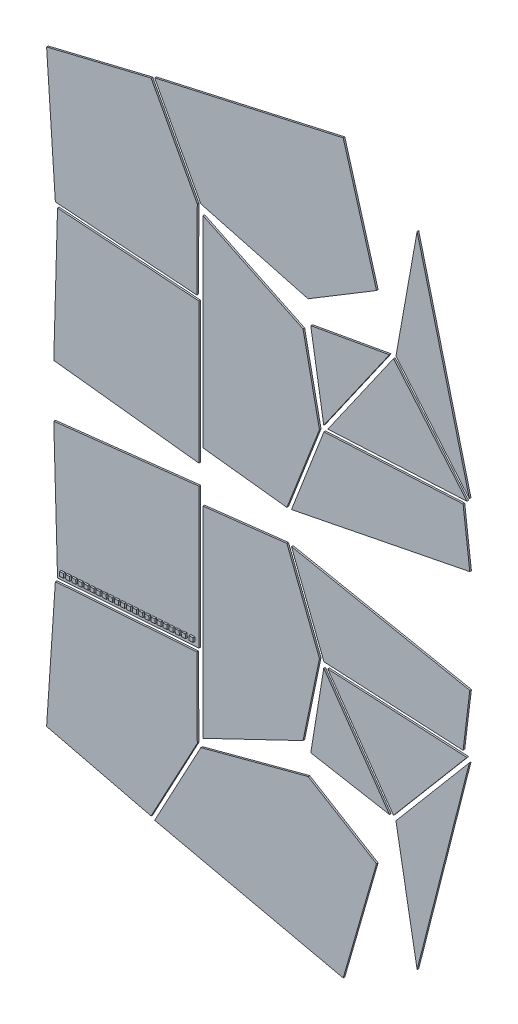
from build123d import *

# Parameters (mm, degrees)
PCBS_DEPTH                = 0.8
PCBS_2_DEPTH              = 0.8
PCBS_3_DEPTH              = 0.8
PCBS_4_DEPTH              = 0.8
PCBS_5_DEPTH              = 0.8
PCBS_6_DEPTH              = 0.8
PCBS_7_DEPTH              = 0.8
PCBS_8_DEPTH              = 0.8
PCBS_9_DEPTH              = 0.8
PCBS_10_DEPTH             = 0.8
PCBS_11_DEPTH             = 0.8
PCBS_12_DEPTH             = 0.8
PCBS_13_DEPTH             = 0.8
PCBS_14_DEPTH             = 0.8
PCBS_15_DEPTH             = 0.8
PCBS_16_DEPTH             = 0.8
BOSS_EXTRUDE3_START       = 65.923845769
BOSS_EXTRUDE3_OUTLINE_W   = 2
BOSS_EXTRUDE3_OUTLINE_H   = 0.9
BOSS_EXTRUDE3_DEPTH       = 2
BOSS_EXTRUDE3_START_2     = 0.8
BOSS_EXTRUDE3_2_OUTLINE_W = 2
BOSS_EXTRUDE3_2_OUTLINE_H = 2
BOSS_EXTRUDE3_2_DEPTH     = 0.9


# Read off the part's stored shape, not the designer's step: Boss-Extrude3
with BuildPart() as part:
    # Sketch4 → PCBs (new body)
    with BuildSketch(Plane(origin=(0, 0, 0), x_dir=(0, 1, 0), z_dir=(0, 0, 1))):
        Polygon((-142.994051427, 105.666926428), (-155.449296427, 54.300119428), (-113.141188427, 31.586162428), (-74.313922427, 31.770174428), (-79.166594427, 101.364311428), align=None)
    extrude(amount=PCBS_DEPTH)


with BuildPart() as body_2:
    # Sketch4 → PCBs 2 (new body)
    with BuildSketch(Plane(origin=(0, 0, 0), x_dir=(0, 1, 0), z_dir=(0, 0, 1))):
        Polygon((-156.394828427, 52.537562428), (-177.205479427, -40.157538572), (-120.370357427, -56.542245572), (-100.033867427, -22.884964572), (-114.086720427, 29.823605428), align=None)
    extrude(amount=PCBS_2_DEPTH)


with BuildPart() as body_3:
    # Sketch4 → PCBs 3 (new body)
    with BuildSketch(Plane(origin=(0, 0, 0), x_dir=(0, 1, 0), z_dir=(0, 0, 1))):
        Polygon((-109.607792425, 28.770968428), (-85.989882427, -20.400875572), (-47.064371427, -28.478112572), (-5.984413427, -12.483116572), (-10.735521427, 28.776809428), align=None)
    extrude(amount=PCBS_3_DEPTH)


with BuildPart() as body_4:
    # Sketch4 → PCBs 4 (new body)
    with BuildSketch(Plane(origin=(0, 0, 0), x_dir=(0, 1, 0), z_dir=(0, 0, 1))):
        Polygon((-89.266124427, -24.217065572), (-96.222750427, -62.920951572), (-50.029798427, -30.616117572), align=None)
    extrude(amount=PCBS_4_DEPTH)


with BuildPart() as body_5:
    # Sketch4 → PCBs 5 (new body)
    with BuildSketch(Plane(origin=(0, 0, 0), x_dir=(0, 1, 0), z_dir=(0, 0, 1))):
        Polygon((-155.488309427, -76.504594572), (-97.259474427, -66.107839572), (-54.558936427, -102.206010572), align=None)
    extrude(amount=PCBS_5_DEPTH)


with BuildPart() as body_6:
    # Sketch4 → PCBs 6 (new body)
    with BuildSketch(Plane(origin=(0, 0, 0), x_dir=(0, 1, 0), z_dir=(0, 0, 1))):
        Polygon((-50.777335427, -99.113221572), (-47.284921427, -30.710215572), (-6.204965427, -14.715221572), (-23.602409427, -102.408002572), align=None)
    extrude(amount=PCBS_6_DEPTH)


with BuildPart() as body_7:
    # Sketch4 → PCBs 7 (new body)
    with BuildSketch(Plane(origin=(0, 0, 0), x_dir=(0, 1, 0), z_dir=(0, 0, 1))):
        Polygon((-52.876714427, -101.008639572), (-95.577251427, -64.910468572), (-49.384299427, -32.605634572), align=None)
    extrude(amount=PCBS_7_DEPTH)


with BuildPart() as body_8:
    # Sketch4 → PCBs 8 (new body)
    with BuildSketch(Plane(origin=(0, 0, 0), x_dir=(0, 1, 0), z_dir=(0, 0, 1))):
        Polygon((-77.086164427, 100.282814428), (-72.239374427, 30.773056428), (-3.211108427, 30.776814428), (-11.272719427, 102.144417428), align=None)
    extrude(amount=PCBS_8_DEPTH)

    # Boss-Extrude3 outline → Boss-Extrude3 (add)
    with BuildSketch(Plane(origin=(0, 0, 0), x_dir=(0.9975778193622782, 0.06955928634195391, 0), z_dir=(0.06955928634195391, -0.9975778193622782, 0)).offset(BOSS_EXTRUDE3_START)):
        with Locations((-42.299603214, 1.25)):
            Rectangle(BOSS_EXTRUDE3_OUTLINE_W, BOSS_EXTRUDE3_OUTLINE_H)
        with Locations((-45.299603214, 1.25)):
            Rectangle(BOSS_EXTRUDE3_OUTLINE_W, BOSS_EXTRUDE3_OUTLINE_H)
        with Locations((-48.299603214, 1.25)):
            Rectangle(BOSS_EXTRUDE3_OUTLINE_W, BOSS_EXTRUDE3_OUTLINE_H)
        with Locations((-51.299603214, 1.25)):
            Rectangle(BOSS_EXTRUDE3_OUTLINE_W, BOSS_EXTRUDE3_OUTLINE_H)
        with Locations((-54.299603214, 1.25)):
            Rectangle(BOSS_EXTRUDE3_OUTLINE_W, BOSS_EXTRUDE3_OUTLINE_H)
        with Locations((-57.299603214, 1.25)):
            Rectangle(BOSS_EXTRUDE3_OUTLINE_W, BOSS_EXTRUDE3_OUTLINE_H)
        with Locations((-60.299603214, 1.25)):
            Rectangle(BOSS_EXTRUDE3_OUTLINE_W, BOSS_EXTRUDE3_OUTLINE_H)
        with Locations((-63.299603214, 1.25)):
            Rectangle(BOSS_EXTRUDE3_OUTLINE_W, BOSS_EXTRUDE3_OUTLINE_H)
        with Locations((-66.299603214, 1.25)):
            Rectangle(BOSS_EXTRUDE3_OUTLINE_W, BOSS_EXTRUDE3_OUTLINE_H)
        with Locations((-69.299603214, 1.25)):
            Rectangle(BOSS_EXTRUDE3_OUTLINE_W, BOSS_EXTRUDE3_OUTLINE_H)
        with Locations((-72.299603214, 1.25)):
            Rectangle(BOSS_EXTRUDE3_OUTLINE_W, BOSS_EXTRUDE3_OUTLINE_H)
        with Locations((-75.299603214, 1.25)):
            Rectangle(BOSS_EXTRUDE3_OUTLINE_W, BOSS_EXTRUDE3_OUTLINE_H)
        with Locations((-78.299603214, 1.25)):
            Rectangle(BOSS_EXTRUDE3_OUTLINE_W, BOSS_EXTRUDE3_OUTLINE_H)
        with Locations((-81.299603214, 1.25)):
            Rectangle(BOSS_EXTRUDE3_OUTLINE_W, BOSS_EXTRUDE3_OUTLINE_H)
        with Locations((-84.299603214, 1.25)):
            Rectangle(BOSS_EXTRUDE3_OUTLINE_W, BOSS_EXTRUDE3_OUTLINE_H)
        with Locations((-87.299603214, 1.25)):
            Rectangle(BOSS_EXTRUDE3_OUTLINE_W, BOSS_EXTRUDE3_OUTLINE_H)
        with Locations((-90.299603214, 1.25)):
            Rectangle(BOSS_EXTRUDE3_OUTLINE_W, BOSS_EXTRUDE3_OUTLINE_H)
        with Locations((-93.299603214, 1.25)):
            Rectangle(BOSS_EXTRUDE3_OUTLINE_W, BOSS_EXTRUDE3_OUTLINE_H)
        with Locations((-96.299603214, 1.25)):
            Rectangle(BOSS_EXTRUDE3_OUTLINE_W, BOSS_EXTRUDE3_OUTLINE_H)
        with Locations((-99.299603214, 1.25)):
            Rectangle(BOSS_EXTRUDE3_OUTLINE_W, BOSS_EXTRUDE3_OUTLINE_H)
        with Locations((-102.299603214, 1.25)):
            Rectangle(BOSS_EXTRUDE3_OUTLINE_W, BOSS_EXTRUDE3_OUTLINE_H)
    extrude(amount=BOSS_EXTRUDE3_DEPTH)

    # Boss-Extrude3 2 outline → Boss-Extrude3 2 (add)
    with BuildSketch(Plane.XY.offset(BOSS_EXTRUDE3_START_2)):
        with Locations((-33.773211627, -69.392303986)):
            Rectangle(BOSS_EXTRUDE3_2_OUTLINE_W, BOSS_EXTRUDE3_2_OUTLINE_H)
    extrude(amount=BOSS_EXTRUDE3_2_DEPTH)


with BuildPart() as body_9:
    # Sketch4 → PCBs 9 (new body)
    with BuildSketch(Plane(origin=(0, 0, 0), x_dir=(0, 1, 0), z_dir=(0, 0, 1))):
        Polygon((14.621265573, 102.144417428), (6.559655573, 30.776814428), (75.587920573, 30.773056428), (80.434710573, 100.282814428), align=None)
    extrude(amount=PCBS_9_DEPTH)


with BuildPart() as body_10:
    # Sketch4 → PCBs 10 (new body)
    with BuildSketch(Plane(origin=(0, 0, 0), x_dir=(0, 1, 0), z_dir=(0, 0, 1))):
        Polygon((82.515140573, 101.364311428), (146.342597573, 105.666926428), (158.797843573, 54.300119428), (116.489735573, 31.586162428), (77.662468573, 31.770174428), align=None)
    extrude(amount=PCBS_10_DEPTH)


with BuildPart() as body_11:
    # Sketch4 → PCBs 11 (new body)
    with BuildSketch(Plane(origin=(0, 0, 0), x_dir=(0, 1, 0), z_dir=(0, 0, 1))):
        Polygon((14.084067573, 28.776809428), (9.332960573, -12.483116572), (50.412918573, -28.478112572), (89.338428573, -20.400875572), (112.956338573, 28.770968428), align=None)
    extrude(amount=PCBS_11_DEPTH)


with BuildPart() as body_12:
    # Sketch4 → PCBs 12 (new body)
    with BuildSketch(Plane(origin=(0, 0, 0), x_dir=(0, 1, 0), z_dir=(0, 0, 1))):
        Polygon((159.743375573, 52.537562428), (117.435267573, 29.823605428), (103.382413573, -22.884964572), (123.718903573, -56.542245572), (180.554025573, -40.157538572), align=None)
    extrude(amount=PCBS_12_DEPTH)


with BuildPart() as body_13:
    # Sketch4 → PCBs 13 (new body)
    with BuildSketch(Plane(origin=(0, 0, 0), x_dir=(0, 1, 0), z_dir=(0, 0, 1))):
        Polygon((9.553511573, -14.715221572), (26.950955573, -102.408002572), (54.125881573, -99.113221572), (50.633467569, -30.71021557), align=None)
    extrude(amount=PCBS_13_DEPTH)


with BuildPart() as body_14:
    # Sketch4 → PCBs 14 (new body)
    with BuildSketch(Plane(origin=(0, 0, 0), x_dir=(0, 1, 0), z_dir=(0, 0, 1))):
        Polygon((53.378345569, -30.61611757), (92.614670573, -24.217065572), (99.571296573, -62.920951572), align=None)
    extrude(amount=PCBS_14_DEPTH)


with BuildPart() as body_15:
    # Sketch4 → PCBs 15 (new body)
    with BuildSketch(Plane(origin=(0, 0, 0), x_dir=(0, 1, 0), z_dir=(0, 0, 1))):
        Polygon((52.732846569, -32.60563457), (56.225260573, -101.008639572), (98.925797573, -64.910468572), align=None)
    extrude(amount=PCBS_15_DEPTH)


with BuildPart() as body_16:
    # Sketch4 → PCBs 16 (new body)
    with BuildSketch(Plane(origin=(0, 0, 0), x_dir=(0, 1, 0), z_dir=(0, 0, 1))):
        Polygon((57.907482573, -102.206010572), (100.608020573, -66.107839572), (158.836855573, -76.504594572), align=None)
    extrude(amount=PCBS_16_DEPTH)


solid = Compound([part.part, body_2.part, body_3.part, body_4.part, body_5.part, body_6.part, body_7.part, body_8.part, body_9.part, body_10.part, body_11.part, body_12.part, body_13.part, body_14.part, body_15.part, body_16.part])
